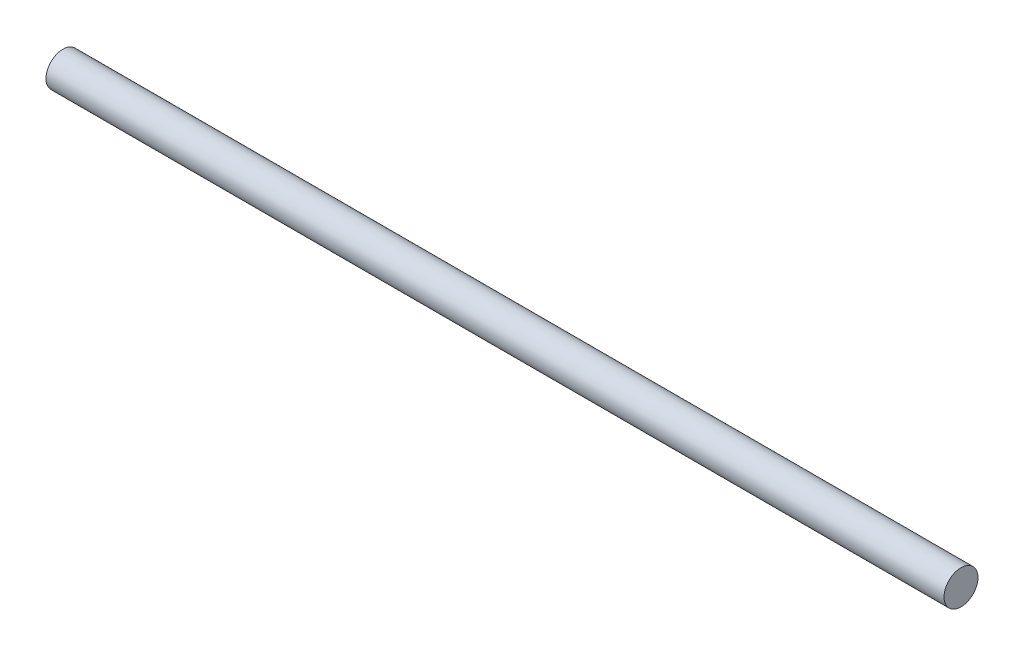
from build123d import *

# Parameters (mm, degrees)
SKETCH1_R           = 0.2921
BOSS_EXTRUDE1_DEPTH = 15.45


with BuildPart() as part:
    # Sketch1 → Boss-Extrude1 (new body)
    with BuildSketch(Plane(origin=(0, 0, 0), x_dir=(0, 0, -1), z_dir=(1, 0, 0))):
        Circle(SKETCH1_R)
    extrude(amount=BOSS_EXTRUDE1_DEPTH)


solid = part.part
